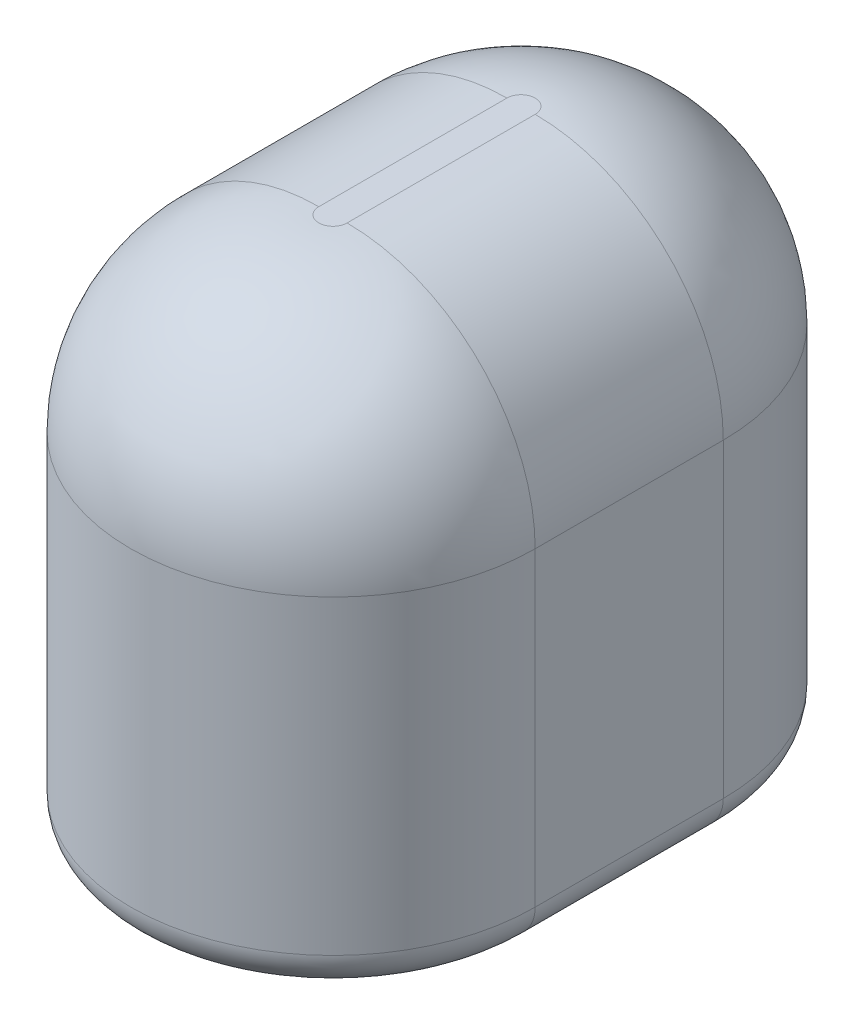
from build123d import *

# Parameters (mm, degrees)
BOSS_EXTRUDE1_DEPTH = 28.5
FILLET2_R           = 10
FILLET3_R           = 2
SKETCH2_R           = 1.75
BOSS_EXTRUDE2_DEPTH = 7
FILLET4_R           = 1
FILLET5_R           = 0.5
SHELL2_T            = 1


with BuildPart() as part:
    # Sketch1 → Boss-Extrude1 (new body)
    with BuildSketch(Plane(origin=(0, 0, 0), x_dir=(1, 0, 0), z_dir=(0, 1, 0))):
        with BuildLine():
            Line((-10.75, -5), (-10.75, 5))
            ThreePointArc((-10.75, 5), (0, 15.75), (10.75, 5))
            Line((10.75, 5), (10.75, -5))
            ThreePointArc((10.75, -5), (0, -15.75), (-10.75, -5))
        make_face()
    extrude(amount=BOSS_EXTRUDE1_DEPTH)

    # Fillet2
    fillet2_edges = [part.edges().sort_by_distance(p)[0] for p in [
        (0, 28.5, -15.75),
        (-10.75, 28.5, 0),
        (0, 28.5, 15.75),
        (10.75, 28.5, 0),
    ]]
    fillet(fillet2_edges, radius=FILLET2_R)

    # Fillet3
    fillet3_edges = [part.edges().sort_by_distance(p)[0] for p in [
        (-10.75, 0, 0),
        (0, 0, -15.75),
        (10.75, 0, 0),
        (0, 0, 15.75),
    ]]
    fillet(fillet3_edges, radius=FILLET3_R)

    # Sketch2 → Boss-Extrude2 (add)
    with BuildSketch(Plane.XZ):
        with Locations(Location((0, 0, 0), (0, 0, 90))):
            Circle(SKETCH2_R)
    extrude(amount=BOSS_EXTRUDE2_DEPTH)

    # Fillet4
    fillet4_edges = [part.edges().sort_by_distance(p)[0] for p in [
        (0, -7, -1.75),
    ]]
    fillet(fillet4_edges, radius=FILLET4_R)

    # Fillet5
    fillet5_edges = [part.edges().sort_by_distance(p)[0] for p in [
        (0, 0, -1.75),
    ]]
    fillet(fillet5_edges, radius=FILLET5_R)

    # Shell2 (no face opened: a closed hollow body)
    add(offset(amount=-SHELL2_T, mode=Mode.PRIVATE), mode=Mode.SUBTRACT)


solid = part.part
